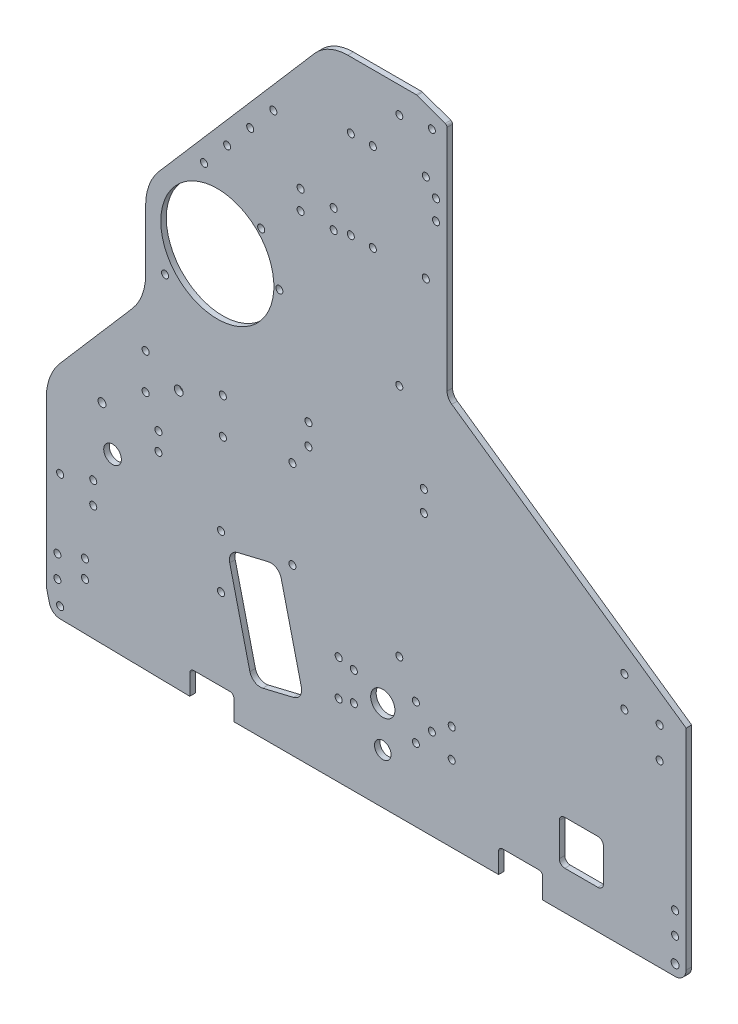
from build123d import *

# Parameters (mm, degrees)
SKETCH1_R           = 2.032
SKETCH1_R_2         = 5.08
SKETCH1_R_3         = 2.54
SKETCH1_R_4         = 2
BOSS_EXTRUDE1_DEPTH = 3.175
FILLET1_R           = 2.286
FILLET2_R           = 6.35
SKETCH2_R           = 2.032
CUT_EXTRUDE1_DEPTH  = 505.524983177
FILLET3_R           = 1.5875
SKETCH3_R           = 2.032
SKETCH3_R_2         = 2.286
CUT_EXTRUDE2_DEPTH  = 505.524983177
SKETCH4_R           = 2.032
SKETCH4_R_2         = 6.985
SKETCH4_R_3         = 4.7625
CUT_EXTRUDE3_DEPTH  = 505.524983177
SKETCH5_R           = 32.54375
SKETCH5_R_2         = 2.286000001
CUT_EXTRUDE5_DEPTH  = 505.524983177
FILLET4_R           = 31.75
CUT_EXTRUDE6_DEPTH  = 505.524983177
FILLET5_R           = 25.4
SKETCH8_R           = 2.031999999
SKETCH8_R_2         = 2.032
CUT_EXTRUDE7_DEPTH  = 505.524983177
SKETCH10_R          = 2.032000001
CUT_EXTRUDE8_DEPTH  = 505.524983177
FILLET6_R           = 6.35
SKETCH11_RX         = 2.032
SKETCH11_RY         = 2.031999502
CUT_EXTRUDE9_DEPTH  = 505.524983177
SKETCH12_R          = 2.032
CUT_EXTRUDE10_DEPTH = 505.524983319


with BuildPart() as part:
    # Sketch1 → Boss-Extrude1 (new body)
    with BuildSketch(Plane.XY):
        with BuildLine():
            Line((7.829508682, -19.049081656), (82.55, -20.32))
            Line((82.55, -20.32), (82.55, -6.35))
            Line((82.55, -6.35), (107.95, -6.35))
            Line((107.95, -6.35), (107.95, -20.32))
            Line((107.95, -20.32), (260.35, -20.32))
            Line((260.35, -20.32), (260.35, -6.35))
            Line((260.35, -6.35), (285.75, -6.35))
            Line((285.75, -6.35), (285.75, -20.32))
            Line((285.75, -20.32), (368.3, -20.32))
            Line((368.3, -20.32), (368.3, 106.68))
            Line((368.3, 106.68), (230.66375, 202.565))
            Line((230.66375, 202.565), (230.66375, 338.455))
            Line((230.66375, 338.455), (213.19998, 344.805))
            Line((213.19998, 344.805), (203.2, 344.805))
            Line((203.2, 344.805), (161.925, 344.805))
            Line((161.925, 344.805), (52.720122664, 218.469945827))
            ThreePointArc((52.720122664, 218.469945827), (52.803835479, 218.142145922), (52.832, 217.805))
            ThreePointArc((52.832, 217.805), (52.095493096, 216.239521914), (50.419872403, 215.808871996))
            Line((50.419872403, 215.808871996), (0, 157.48))
            Line((0, 157.48), (0, 0))
            Line((0, 0), (0, -6.35))
            ThreePointArc((0, -6.35), (0.047577015, -7.125863724), (0.189595124, -7.890101219))
            Line((0.189595124, -7.890101219), (1.777095124, -14.240101219))
            ThreePointArc((1.777095124, -14.240101219), (3.987212552, -17.671692778), (7.829508682, -19.049081656))
        make_face()
        with Locations((7.9375, -12.7)):
            Circle(SKETCH1_R, mode=Mode.SUBTRACT)
        with Locations((6.35, 0)):
            Circle(SKETCH1_R, mode=Mode.SUBTRACT)
        with Locations((6.35, 12.7)):
            Circle(SKETCH1_R, mode=Mode.SUBTRACT)
        with Locations((38.1, 78.105)):
            Circle(SKETCH1_R_2, mode=Mode.SUBTRACT)
        with Locations((57.15, 118.58625)):
            Circle(SKETCH1_R, mode=Mode.SUBTRACT)
        with Locations((57.15, 139.22375)):
            Circle(SKETCH1_R, mode=Mode.SUBTRACT)
        with Locations((76.2, 128.905)):
            Circle(SKETCH1_R_3, mode=Mode.SUBTRACT)
        with Locations((101.6, 118.58625)):
            Circle(SKETCH1_R, mode=Mode.SUBTRACT)
        with Locations((101.6, 139.22375)):
            Circle(SKETCH1_R, mode=Mode.SUBTRACT)
        with Locations((203.2, 59.805)):
            Circle(SKETCH1_R_4, mode=Mode.SUBTRACT)
        with Locations((361.95, 0)):
            Circle(SKETCH1_R, mode=Mode.SUBTRACT)
        with Locations((361.95, 12.7)):
            Circle(SKETCH1_R, mode=Mode.SUBTRACT)
        with Locations((353.06, 82.955052336)):
            Circle(SKETCH1_R, mode=Mode.SUBTRACT)
        with Locations((332.74, 98.195052336)):
            Circle(SKETCH1_R, mode=Mode.SUBTRACT)
        with Locations((332.74, 115.975052336)):
            Circle(SKETCH1_R, mode=Mode.SUBTRACT)
        with Locations((353.06, 100.735052336)):
            Circle(SKETCH1_R, mode=Mode.SUBTRACT)
        with Locations((68.326, 182.923674932)):
            Circle(SKETCH1_R, mode=Mode.SUBTRACT)
        with Locations((76.2, 217.805)):
            Circle(SKETCH1_R, mode=Mode.SUBTRACT)
        with Locations((90.779500502, 249.682)):
            Circle(SKETCH1_R, mode=Mode.SUBTRACT)
        with Locations((104.067838673, 265.054783374)):
            Circle(SKETCH1_R, mode=Mode.SUBTRACT)
        with Locations((117.356176844, 280.427566748)):
            Circle(SKETCH1_R, mode=Mode.SUBTRACT)
        with Locations((130.644515014, 295.800350122)):
            Circle(SKETCH1_R, mode=Mode.SUBTRACT)
        with Locations((203.2, 194.805)):
            Circle(SKETCH1_R_4, mode=Mode.SUBTRACT)
        with Locations((224.31375, 287.401)):
            Circle(SKETCH1_R, mode=Mode.SUBTRACT)
        with Locations((224.31375, 298.831)):
            Circle(SKETCH1_R, mode=Mode.SUBTRACT)
        with Locations((203.2, 329.805)):
            Circle(SKETCH1_R_4, mode=Mode.SUBTRACT)
        with Locations((221.931865, 332.105)):
            Circle(SKETCH1_R_4, mode=Mode.SUBTRACT)
    extrude(amount=BOSS_EXTRUDE1_DEPTH)

    # Fillet1
    fillet1_edges = [part.edges().sort_by_distance(p)[0] for p in [
        (285.75, -6.35, 1.5875),
        (107.95, -6.35, 1.5875),
        (260.35, -6.35, 1.5875),
        (82.55, -6.35, 1.5875),
    ]]
    fillet(fillet1_edges, radius=FILLET1_R)

    # Fillet2
    fillet2_edges = [part.edges().sort_by_distance(p)[0] for p in [
        (230.66375, 202.565, 1.5875),
    ]]
    fillet(fillet2_edges, radius=FILLET2_R)

    # Sketch2 → Cut-Extrude1 (cut, through all)
    with BuildSketch(Plane(origin=(0, 0, 0), x_dir=(-1, 0, 0), z_dir=(0, 0, -1))):
        with Locations((-100.552770272, 71.086035298)):
            Circle(SKETCH2_R)
        with Locations((-100.552770272, 40.606035298)):
            Circle(SKETCH2_R)
        with Locations((-22.225, 18.202541089)):
            Circle(SKETCH2_R)
        with Locations((-22.225, 8.042541089)):
            Circle(SKETCH2_R)
    extrude(amount=-CUT_EXTRUDE1_DEPTH, mode=Mode.SUBTRACT)

    # Fillet3
    fillet3_edges = [part.edges().sort_by_distance(p)[0] for p in [
        (230.66375, 338.455, 1.5875),
        (213.19998, 344.805, 1.5875),
    ]]
    fillet(fillet3_edges, radius=FILLET3_R)

    # Sketch3 → Cut-Extrude2 (cut, through all)
    with BuildSketch(Plane.XY.offset(3.175)):
        with BuildLine():
            Line((127.789350211, 69.359774106), (110.090750339, 65.117184968))
            ThreePointArc((110.090750339, 65.117184968), (106.287939856, 62.356288953), (105.55119507, 57.715047577))
            Line((105.55119507, 57.715047577), (117.160037875, 9.287010566))
            ThreePointArc((117.160037875, 9.287010566), (119.92093389, 5.484200083), (124.562175266, 4.747455297))
            Line((124.562175266, 4.747455297), (142.260775137, 8.990044434))
            ThreePointArc((142.260775137, 8.990044434), (146.063585621, 11.75094045), (146.800330407, 16.392181825))
            Line((146.800330407, 16.392181825), (135.191487602, 64.820218836))
            ThreePointArc((135.191487602, 64.820218836), (132.430591586, 68.62302932), (127.789350211, 69.359774106))
        make_face()
        with Locations((26.987500002, 46.953113935)):
            Circle(SKETCH3_R)
        with Locations((26.987500002, 59.653113935)):
            Circle(SKETCH3_R)
        with Locations((7.937500002, 53.303113935)):
            Circle(SKETCH3_R)
        with Locations((32.030600738, 100.810868776)):
            Circle(SKETCH3_R_2)
        with Locations((64.525942114, 102.94048958)):
            Circle(SKETCH3_R)
        with Locations((64.525942114, 92.525786339)):
            Circle(SKETCH3_R)
        with Locations((134.14375, 208.228121768)):
            Circle(SKETCH3_R)
        with Locations((123.681970341, 233.485092108)):
            Circle(SKETCH3_R)
    extrude(amount=-CUT_EXTRUDE2_DEPTH, mode=Mode.SUBTRACT)

    # Sketch4 → Cut-Extrude3 (cut, through all)
    with BuildSketch(Plane.XY.offset(3.175)):
        with Locations((168.275, 42.06875)):
            Circle(SKETCH4_R)
        with Locations((212.725, 42.06875)):
            Circle(SKETCH4_R)
        with Locations((212.725, 21.43125)):
            Circle(SKETCH4_R)
        with Locations((168.275, 21.43125)):
            Circle(SKETCH4_R)
        with Locations((193.675, 31.75)):
            Circle(SKETCH4_R_2)
        with Locations((177.00498, 40.0431)):
            Circle(SKETCH4_R)
        with Locations((177.00498, 23.4569)):
            Circle(SKETCH4_R)
        with Locations((193.675, 8.466666658)):
            Circle(SKETCH4_R_3)
        with Locations((221.931865, 31.75)):
            Circle(SKETCH4_R)
        with Locations((233.36123, 23.4569)):
            Circle(SKETCH4_R)
        with Locations((233.36123, 40.0431)):
            Circle(SKETCH4_R)
    extrude(amount=-CUT_EXTRUDE3_DEPTH, mode=Mode.SUBTRACT)

    # Sketch5 → Cut-Extrude5 (cut, through all)
    with BuildSketch(Plane(origin=(0, 0, 0), x_dir=(-1, 0, 0), z_dir=(0, 0, -1))):
        Polygon((0, 157.48), (-57.15, 223.594705882), (-57.15, 165.333696112), (0, 99.218990229), align=None)
        with Locations((-98.425, 208.228121768)):
            Circle(SKETCH5_R)
        with Locations((-361.95, -13.97)):
            Circle(SKETCH5_R_2)
    extrude(amount=-CUT_EXTRUDE5_DEPTH, mode=Mode.SUBTRACT)

    # Fillet4
    fillet4_edges = [part.edges().sort_by_distance(p)[0] for p in [
        (0, 99.218990229, 1.5875),
        (57.15, 165.333696112, 1.5875),
        (57.15, 223.594705882, 1.5875),
    ]]
    fillet(fillet4_edges, radius=FILLET4_R)

    # Sketch6 → Cut-Extrude6 (cut, through all)
    with BuildSketch(Plane.XY.offset(3.175)):
        with BuildLine():
            Line((298.45, 27.305), (317.5, 27.305))
            ThreePointArc((317.5, 27.305), (319.74506403, 26.37506403), (320.675, 24.13))
            Line((320.675, 24.13), (320.675, 5.08))
            ThreePointArc((320.675, 5.08), (319.74506403, 2.83493597), (317.5, 1.905))
            Line((317.5, 1.905), (298.45, 1.905))
            ThreePointArc((298.45, 1.905), (296.20493597, 2.83493597), (295.275, 5.08))
            Line((295.275, 5.08), (295.275, 24.13))
            ThreePointArc((295.275, 24.13), (296.20493597, 26.37506403), (298.45, 27.305))
        make_face()
    extrude(amount=-CUT_EXTRUDE6_DEPTH, mode=Mode.SUBTRACT)

    # Fillet5
    fillet5_edges = [part.edges().sort_by_distance(p)[0] for p in [
        (161.925, 344.805, 1.5875),
    ]]
    fillet(fillet5_edges, radius=FILLET5_R)

    # Sketch8 → Cut-Extrude7 (cut, through all)
    with BuildSketch(Plane(origin=(0, 0, 0), x_dir=(-1, 0, 0), z_dir=(0, 0, -1))):
        with Locations((-187.96, 306.70500001)):
            Circle(SKETCH8_R)
        with Locations((-175.26, 306.70500001)):
            Circle(SKETCH8_R_2)
        with Locations((-218.44, 306.704999997)):
            Circle(SKETCH8_R_2)
        with Locations((-218.44, 255.904999997)):
            Circle(SKETCH8_R_2)
        with Locations((-187.96, 255.90500001)):
            Circle(SKETCH8_R)
        with Locations((-175.26, 255.90500001)):
            Circle(SKETCH8_R_2)
    extrude(amount=-CUT_EXTRUDE7_DEPTH, mode=Mode.SUBTRACT)

    # Sketch10 → Cut-Extrude8 (cut, through all)
    with BuildSketch(Plane.XY.offset(3.175)):
        with Locations((141.642479999, 74.684371768)):
            Circle(SKETCH10_R)
        with Locations((141.642479999, 125.484371768)):
            Circle(SKETCH10_R)
    extrude(amount=-CUT_EXTRUDE8_DEPTH, mode=Mode.SUBTRACT)

    # Fillet6
    fillet6_edges = [part.edges().sort_by_distance(p)[0] for p in [
        (368.3, -20.32, 1.5875),
    ]]
    fillet(fillet6_edges, radius=FILLET6_R)

    # Sketch11 → Cut-Extrude9 (cut, through all)
    with BuildSketch(Plane.XY.offset(3.175)):
        with Locations(Location((150.881424454, 138.43), (0, 0, 90))):
            Ellipse(SKETCH11_RX, SKETCH11_RY)
        with Locations(Location((150.881424454, 150.495), (0, 0, 90))):
            Ellipse(SKETCH11_RX, SKETCH11_RY)
        with Locations(Location((217.30240818, 150.495), (0, 0, 90))):
            Ellipse(SKETCH11_RX, SKETCH11_RY)
        with Locations(Location((217.30240818, 138.43), (0, 0, 90))):
            Ellipse(SKETCH11_RX, SKETCH11_RY)
    extrude(amount=-CUT_EXTRUDE9_DEPTH, mode=Mode.SUBTRACT)

    # Sketch12 → Cut-Extrude10 (cut, through all)
    with BuildSketch(Plane(origin=(0, 0, 0), x_dir=(-1, 0, 0), z_dir=(0, 0, -1))):
        with Locations((-165.4175, 264.63498)):
            Circle(SKETCH12_R)
        with Locations((-165.4175, 253.52248)):
            Circle(SKETCH12_R)
        with Locations((-146.3675, 253.52248)):
            Circle(SKETCH12_R)
        with Locations((-146.3675, 264.63498)):
            Circle(SKETCH12_R)
    extrude(amount=-CUT_EXTRUDE10_DEPTH, mode=Mode.SUBTRACT)


solid = part.part
